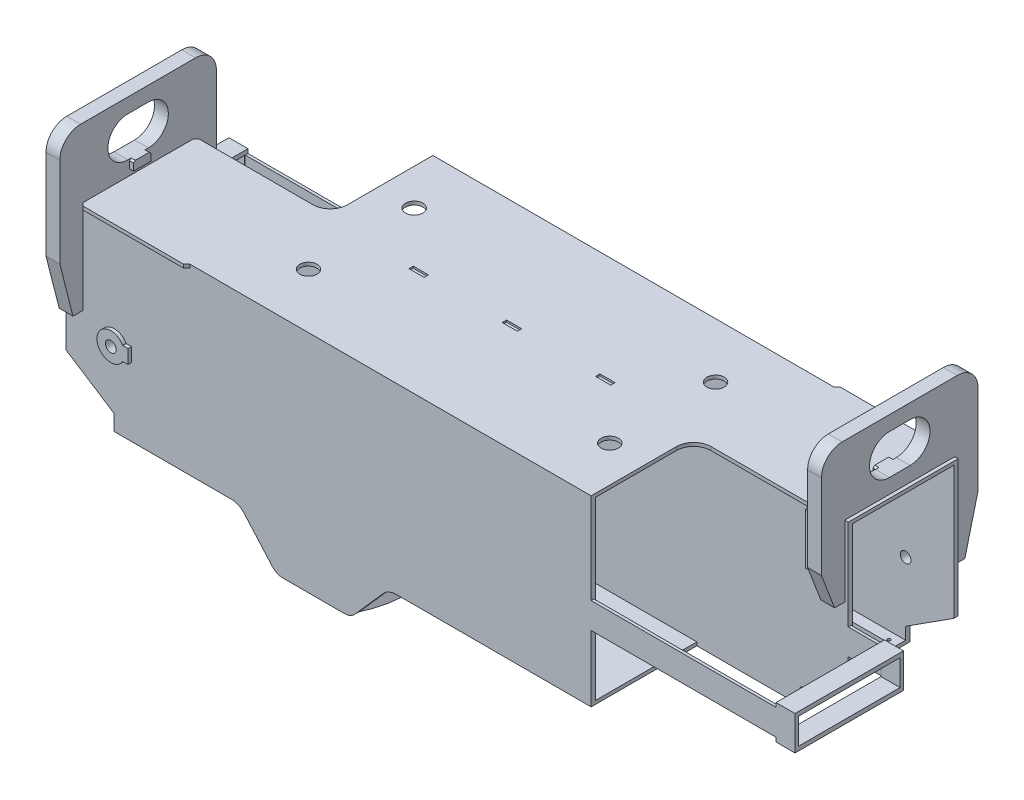
from build123d import *

# Parameters (mm, degrees)
EXTRUDE_1_DEPTH           = 12
EXTRUDE_2_DEPTH           = 12
SKETCH_4_R                = 15.5
CUT_EXTRUDE_1_DEPTH       = 12
EXTRUDE_3_DEPTH           = 12
SKETCH_7_R                = 15.5
CUT_EXTRUDE_2_DEPTH       = 12
EXTRUDE_4_DEPTH           = 10
SKETCH_11_R               = 25
CUT_EXTRUDE_4_DEPTH       = 10
SKETCH_13_W               = 44
SKETCH_13_H               = 12.5
CUT_EXTRUDE_6_DEPTH       = 10
SKETCH_14_W               = 44
SKETCH_14_H               = 12
EXTRUDE_5_DEPTH           = 5
EXTRUDE_6_DEPTH           = 10
SKETCH_17_R               = 4.5
SKETCH_17_W               = 141
SKETCH_17_H               = 31
CUT_EXTRUDE_8_DEPTH       = 10
EXTRUDE_7_DEPTH           = 10
SKETCH_20_R               = 4.5
SKETCH_20_W               = 141
SKETCH_20_H               = 31
CUT_EXTRUDE_10_DEPTH      = 10
EXTRUDE_8_DEPTH           = 40
CUT_EXTRUDE_12_DEPTH      = 40
EXTRUDE_9_DEPTH           = 40
CUT_EXTRUDE_14_DEPTH      = 40
EXTRUDE_10_DEPTH          = 12
SKETCH_31_W               = 294
SKETCH_31_H               = 130
EXTRUDE_11_DEPTH          = 10
EXTRUDE_12_DEPTH          = 294
CUT_EXTRUDE_15_DEPTH      = 2201.767422969
CUT_EXTRUDE_15_DEPTH_BACK = 2201.767422969
CUT_EXTRUDE_16_DEPTH      = 2201.767422969
CUT_EXTRUDE_16_DEPTH_BACK = 2201.767422969
EXTRUDE_13_DEPTH          = 12
SKETCH_38_W               = 294
SKETCH_38_H               = 130
EXTRUDE_14_DEPTH          = 10
EXTRUDE_15_DEPTH          = 294
CUT_EXTRUDE_17_DEPTH      = 2201.767422969
CUT_EXTRUDE_17_DEPTH_BACK = 2201.767422969
CUT_EXTRUDE_18_DEPTH      = 2201.767422969
CUT_EXTRUDE_18_DEPTH_BACK = 2201.767422969
SKETCH_44_W               = 535
SKETCH_44_H               = 75
EXTRUDE_16_DEPTH          = 8
SKETCH_45_W               = 535
SKETCH_45_H               = 75
EXTRUDE_17_DEPTH          = 8
SKETCH_47_W               = 97
SKETCH_47_H               = 75
EXTRUDE_18_DEPTH          = 8
SKETCH_48_W               = 97
SKETCH_48_H               = 75
EXTRUDE_19_DEPTH          = 8
SKETCH_50_W               = 314
SKETCH_50_H               = 99
EXTRUDE_20_DEPTH          = 55
SKETCH_52_W               = 294
SKETCH_52_H               = 75
CUT_EXTRUDE_20_DEPTH      = 55
SKETCH_54_W               = 314
SKETCH_54_H               = 99
EXTRUDE_21_DEPTH          = 55
SKETCH_56_W               = 294
SKETCH_56_H               = 75
CUT_EXTRUDE_22_DEPTH      = 55
EXTRUDE_22_DEPTH          = 12
SKETCH_58_R               = 3.4
CUT_EXTRUDE_23_DEPTH      = 12
EXTRUDE_23_DEPTH          = 12
SKETCH_60_R               = 3.4
CUT_EXTRUDE_24_DEPTH      = 12
EXTRUDE_24_DEPTH          = 8
EXTRUDE_25_DEPTH          = 8
EXTRUDE_26_DEPTH          = 12
EXTRUDE_27_DEPTH          = 12
EXTRUDE_28_DEPTH          = 7
EXTRUDE_29_DEPTH          = 7
EXTRUDE_30_DEPTH          = 10
SKETCH_73_R               = 15.5
CUT_EXTRUDE_25_DEPTH      = 10
EXTRUDE_31_DEPTH          = 10
SKETCH_76_R               = 15.5
CUT_EXTRUDE_26_DEPTH      = 10


with BuildPart() as part:
    # ｽｹｯﾁ2 → ﾎﾞｽ - 押し出し1 (new body)
    with BuildSketch(Plane.XY.offset(-306)):
        with BuildLine():
            Line((140, 0), (478.29, 0))
            ThreePointArc((478.29, 0), (498.841586236, -4.418947981), (515.760516852, -16.894707873))
            Line((515.760516852, -16.894707873), (597.563586518, -109.484233702))
            ThreePointArc((597.563586518, -109.484233702), (611.098731011, -119.464841615), (627.54, -123))
            Line((627.54, -123), (806.46, -123))
            ThreePointArc((806.46, -123), (822.901268989, -119.464841615), (836.436413482, -109.484233702))
            Line((836.436413482, -109.484233702), (918.239483148, -16.894707873))
            ThreePointArc((918.239483148, -16.894707873), (935.158413764, -4.418947981), (955.71, 0))
            Line((955.71, 0), (1002.29, 0))
            ThreePointArc((1002.29, 0), (1022.841586236, -4.418947981), (1039.760516852, -16.894707873))
            Line((1039.760516852, -16.894707873), (1121.563586518, -109.484233702))
            ThreePointArc((1121.563586518, -109.484233702), (1135.098731011, -119.464841615), (1151.54, -123))
            Line((1151.54, -123), (1330.46, -123))
            ThreePointArc((1330.46, -123), (1346.901268989, -119.464841615), (1360.436413482, -109.484233702))
            Line((1360.436413482, -109.484233702), (1442.239483148, -16.894707873))
            ThreePointArc((1442.239483148, -16.894707873), (1459.158413764, -4.418947981), (1479.71, 0))
            Line((1479.71, 0), (1818, 0))
            Line((1818, 0), (1818, 45))
            Line((1818, 45), (1958, 135))
            Line((1958, 135), (1958, 519))
            Line((1958, 519), (0, 519))
            Line((0, 519), (0, 135))
            Line((0, 135), (140, 45))
            Line((140, 45), (140, 0))
        make_face()
    extrude(amount=-EXTRUDE_1_DEPTH)



with BuildPart() as body_2:
    # ｽｹｯﾁ3 → ﾎﾞｽ - 押し出し2 (new body)
    with BuildSketch(Plane.XY):
        with BuildLine():
            Line((140, 0), (478.29, 0))
            ThreePointArc((478.29, 0), (498.841586236, -4.418947981), (515.760516852, -16.894707873))
            Line((515.760516852, -16.894707873), (597.563586518, -109.484233702))
            ThreePointArc((597.563586518, -109.484233702), (611.098731011, -119.464841615), (627.54, -123))
            Line((627.54, -123), (806.46, -123))
            ThreePointArc((806.46, -123), (822.901268989, -119.464841615), (836.436413482, -109.484233702))
            Line((836.436413482, -109.484233702), (918.239483148, -16.894707873))
            ThreePointArc((918.239483148, -16.894707873), (935.158413764, -4.418947981), (955.71, 0))
            Line((955.71, 0), (1520, 0))
            Line((1520, 0), (1520, 519))
            Line((1520, 519), (0, 519))
            Line((0, 519), (0, 135))
            Line((0, 135), (140, 45))
            Line((140, 45), (140, 0))
        make_face()
    extrude(amount=-EXTRUDE_2_DEPTH)

    # ｽｹｯﾁ4 → ｶｯﾄ - 押し出し1 (cut)
    with BuildSketch(Plane.XY):
        with Locations((140, 218)):
            Circle(SKETCH_4_R)
    extrude(amount=-CUT_EXTRUDE_1_DEPTH, mode=Mode.SUBTRACT)


with BuildPart() as body_3:
    # ｽｹｯﾁ6 → ﾎﾞｽ - 押し出し3 (new body)
    with BuildSketch(Plane.XY.offset(-612)):
        with BuildLine():
            Line((1818, 0), (1479.71, 0))
            ThreePointArc((1479.71, 0), (1459.158413764, -4.418947981), (1442.239483148, -16.894707873))
            Line((1442.239483148, -16.894707873), (1360.436413482, -109.484233702))
            ThreePointArc((1360.436413482, -109.484233702), (1346.901268989, -119.464841615), (1330.46, -123))
            Line((1330.46, -123), (1151.54, -123))
            ThreePointArc((1151.54, -123), (1135.098731011, -119.464841615), (1121.563586518, -109.484233702))
            Line((1121.563586518, -109.484233702), (1039.760516852, -16.894707873))
            ThreePointArc((1039.760516852, -16.894707873), (1022.841586236, -4.418947981), (1002.29, 0))
            Line((1002.29, 0), (438, 0))
            Line((438, 0), (438, 519))
            Line((438, 519), (1958, 519))
            Line((1958, 519), (1958, 135))
            Line((1958, 135), (1818, 45))
            Line((1818, 45), (1818, 0))
        make_face()
    extrude(amount=-EXTRUDE_3_DEPTH)

    # ｽｹｯﾁ7 → ｶｯﾄ - 押し出し2 (cut)
    with BuildSketch(Plane.XY.offset(-612)):
        with Locations((1818, 218)):
            Circle(SKETCH_7_R)
    extrude(amount=-CUT_EXTRUDE_2_DEPTH, mode=Mode.SUBTRACT)


with BuildPart() as part_1:
    add(part.part)

    add(body_2.part)  # ﾎﾞｽ - 押し出し4 merges body 2

    add(body_3.part)  # ﾎﾞｽ - 押し出し4 merges body 3
    # ｽｹｯﾁ9 → ﾎﾞｽ - 押し出し4 (add)
    with BuildSketch(Plane(origin=(0, 519, 0), x_dir=(1, 0, 0), z_dir=(0, 1, 0))):
        with BuildLine():
            Line((0, 0), (50, 0))
            Line((50, 0), (59, -9))
            Line((59, -9), (350, -9))
            Line((350, -9), (359, 0))
            Line((359, 0), (1520, 0))
            Line((1520, 0), (1520, 247))
            ThreePointArc((1520, 247), (1534.644660941, 282.355339059), (1570, 297))
            Line((1570, 297), (1899, 297))
            Line((1899, 297), (1908, 306))
            Line((1908, 306), (1958, 306))
            Line((1958, 306), (1958, 624))
            Line((1958, 624), (1908, 624))
            Line((1908, 624), (1899, 633))
            Line((1899, 633), (1608, 633))
            Line((1608, 633), (1599, 624))
            Line((1599, 624), (438, 624))
            Line((438, 624), (438, 377))
            ThreePointArc((438, 377), (423.355339059, 341.644660941), (388, 327))
            Line((388, 327), (59, 327))
            Line((59, 327), (50, 318))
            Line((50, 318), (0, 318))
            Line((0, 318), (0, 0))
        make_face()
    extrude(amount=EXTRUDE_4_DEPTH)

    # ｽｹｯﾁ11 → ｶｯﾄ - 押し出し4 (cut)
    with BuildSketch(Plane(origin=(0, 519, 0), x_dir=(1, 0, 0), z_dir=(0, 1, 0))):
        with Locations((543, 159)):
            Circle(SKETCH_11_R)
        with Locations((1415, 159)):
            Circle(SKETCH_11_R)
        with Locations((543, 465)):
            Circle(SKETCH_11_R)
        with Locations((1415, 465)):
            Circle(SKETCH_11_R)
    extrude(amount=CUT_EXTRUDE_4_DEPTH, mode=Mode.SUBTRACT)

    # ｽｹｯﾁ13 → ｶｯﾄ - 押し出し6 (cut)
    with BuildSketch(Plane(origin=(0, 519, 0), x_dir=(1, 0, 0), z_dir=(0, 1, 0))):
        with Locations((709, 312)):
            Rectangle(SKETCH_13_W, SKETCH_13_H)
        with Locations((979, 312)):
            Rectangle(SKETCH_13_W, SKETCH_13_H)
        with Locations((1249, 312)):
            Rectangle(SKETCH_13_W, SKETCH_13_H)
    extrude(amount=CUT_EXTRUDE_6_DEPTH, mode=Mode.SUBTRACT)

    # ｽｹｯﾁ14 → ﾎﾞｽ - 押し出し5 (add)
    with BuildSketch(Plane(origin=(0, 519, 0), x_dir=(1, 0, 0), z_dir=(0, 1, 0))):
        with Locations((709, 312)):
            Rectangle(SKETCH_14_W, SKETCH_14_H)
        with Locations((979, 312)):
            Rectangle(SKETCH_14_W, SKETCH_14_H)
        with Locations((1249, 312)):
            Rectangle(SKETCH_14_W, SKETCH_14_H)
    extrude(amount=EXTRUDE_5_DEPTH)

    # ｽｹｯﾁ15 → ﾎﾞｽ - 押し出し6 (add)
    with BuildSketch(Plane(origin=(0, 0, 0), x_dir=(1, 0, 0), z_dir=(0, 1, 0))):
        with BuildLine():
            Line((140, 12), (1520, 12))
            Line((1520, 12), (1520, 306))
            Line((1520, 306), (140, 306))
            Line((140, 306), (140, 204))
            Line((140, 204), (170, 204))
            ThreePointArc((170, 204), (201.819805153, 190.819805153), (215, 159))
            ThreePointArc((215, 159), (201.819805153, 127.180194847), (170, 114))
            Line((170, 114), (140, 114))
            Line((140, 114), (140, 12))
        make_face()
    extrude(amount=EXTRUDE_6_DEPTH)

    # ｽｹｯﾁ17 → ｶｯﾄ - 押し出し8 (cut)
    with BuildSketch(Plane(origin=(0, 0, 0), x_dir=(1, 0, 0), z_dir=(0, 1, 0))):
        with Locations((165.5, 34.5)):
            Circle(SKETCH_17_R)
        with Locations((293.5, 34.5)):
            Circle(SKETCH_17_R)
        with Locations((165.5, 82.5)):
            Circle(SKETCH_17_R)
        with Locations((293.5, 82.5)):
            Circle(SKETCH_17_R)
        with Locations((165.5, 235.5)):
            Circle(SKETCH_17_R)
        with Locations((293.5, 235.5)):
            Circle(SKETCH_17_R)
        with Locations((165.5, 283.5)):
            Circle(SKETCH_17_R)
        with Locations((293.5, 283.5)):
            Circle(SKETCH_17_R)
        with Locations((229.5, 58.5)):
            Rectangle(SKETCH_17_W, SKETCH_17_H)
        with Locations((229.5, 259.5)):
            Rectangle(SKETCH_17_W, SKETCH_17_H)
    extrude(amount=CUT_EXTRUDE_8_DEPTH, mode=Mode.SUBTRACT)

    # ｽｹｯﾁ18 → ﾎﾞｽ - 押し出し7 (add)
    with BuildSketch(Plane(origin=(0, 0, 0), x_dir=(1, 0, 0), z_dir=(0, 1, 0))):
        with BuildLine():
            Line((1818, 612), (438, 612))
            Line((438, 612), (438, 318))
            Line((438, 318), (1818, 318))
            Line((1818, 318), (1818, 420))
            Line((1818, 420), (1788, 420))
            ThreePointArc((1788, 420), (1756.180194847, 433.180194847), (1743, 465))
            ThreePointArc((1743, 465), (1756.180194847, 496.819805153), (1788, 510))
            Line((1788, 510), (1818, 510))
            Line((1818, 510), (1818, 612))
        make_face()
    extrude(amount=EXTRUDE_7_DEPTH)

    # ｽｹｯﾁ20 → ｶｯﾄ - 押し出し10 (cut)
    with BuildSketch(Plane(origin=(0, 0, 0), x_dir=(1, 0, 0), z_dir=(0, 1, 0))):
        with Locations((1792.5, 589.5)):
            Circle(SKETCH_20_R)
        with Locations((1664.5, 589.5)):
            Circle(SKETCH_20_R)
        with Locations((1792.5, 541.5)):
            Circle(SKETCH_20_R)
        with Locations((1664.5, 541.5)):
            Circle(SKETCH_20_R)
        with Locations((1792.5, 388.5)):
            Circle(SKETCH_20_R)
        with Locations((1664.5, 388.5)):
            Circle(SKETCH_20_R)
        with Locations((1792.5, 340.5)):
            Circle(SKETCH_20_R)
        with Locations((1664.5, 340.5)):
            Circle(SKETCH_20_R)
        with Locations((1728.5, 565.5)):
            Rectangle(SKETCH_20_W, SKETCH_20_H)
        with Locations((1728.5, 364.5)):
            Rectangle(SKETCH_20_W, SKETCH_20_H)
    extrude(amount=CUT_EXTRUDE_10_DEPTH, mode=Mode.SUBTRACT)

    # ｽｹｯﾁ22 → ﾎﾞｽ - 押し出し8 (add)
    with BuildSketch(Plane(origin=(10, 0, 0), x_dir=(0, 0, -1), z_dir=(1, 0, 0))):
        with BuildLine():
            Line((0, 259), (-29.5, 259))
            Line((-29.5, 259), (-67.5, 409))
            Line((-67.5, 409), (-67.5, 669))
            ThreePointArc((-67.5, 669), (-49.926406871, 711.426406871), (-7.5, 729))
            Line((-7.5, 729), (325.5, 729))
            ThreePointArc((325.5, 729), (367.926406871, 711.426406871), (385.5, 669))
            Line((385.5, 669), (385.5, 424))
            Line((385.5, 424), (347.5, 324))
            Line((347.5, 324), (318, 324))
            Line((318, 324), (318, 529))
            Line((318, 529), (0, 529))
            Line((0, 529), (0, 259))
        make_face()
    extrude(amount=EXTRUDE_8_DEPTH)

    # ｽｹｯﾁ24 → ｶｯﾄ - 押し出し12 (cut)
    with BuildSketch(Plane(origin=(10, 0, 0), x_dir=(0, 0, -1), z_dir=(1, 0, 0))):
        with BuildLine():
            Line((129, 686.5), (189, 686.5))
            ThreePointArc((189, 686.5), (229.658639918, 669.658639918), (246.5, 629))
            ThreePointArc((246.5, 629), (229.658639918, 588.341360082), (189, 571.5))
            Line((189, 571.5), (129, 571.5))
            ThreePointArc((129, 571.5), (88.341360082, 588.341360082), (71.5, 629))
            ThreePointArc((71.5, 629), (88.341360082, 669.658639918), (129, 686.5))
        make_face()
    extrude(amount=CUT_EXTRUDE_12_DEPTH, mode=Mode.SUBTRACT)

    # ｽｹｯﾁ26 → ﾎﾞｽ - 押し出し9 (add)
    with BuildSketch(Plane(origin=(1908, 0, 0), x_dir=(0, 0, -1), z_dir=(1, 0, 0))):
        with BuildLine():
            Line((624, 259), (653.5, 259))
            Line((653.5, 259), (691.5, 409))
            Line((691.5, 409), (691.5, 669))
            ThreePointArc((691.5, 669), (673.926406871, 711.426406871), (631.5, 729))
            Line((631.5, 729), (298.5, 729))
            ThreePointArc((298.5, 729), (256.073593129, 711.426406871), (238.5, 669))
            Line((238.5, 669), (238.5, 424))
            Line((238.5, 424), (276.5, 324))
            Line((276.5, 324), (306, 324))
            Line((306, 324), (306, 529))
            Line((306, 529), (624, 529))
            Line((624, 529), (624, 259))
        make_face()
    extrude(amount=EXTRUDE_9_DEPTH)

    # ｽｹｯﾁ28 → ｶｯﾄ - 押し出し14 (cut)
    with BuildSketch(Plane(origin=(1908, 0, 0), x_dir=(0, 0, -1), z_dir=(1, 0, 0))):
        with BuildLine():
            Line((495, 686.5), (435, 686.5))
            ThreePointArc((435, 686.5), (394.341360082, 669.658639918), (377.5, 629))
            ThreePointArc((377.5, 629), (394.341360082, 588.341360082), (435, 571.5))
            Line((435, 571.5), (495, 571.5))
            ThreePointArc((495, 571.5), (535.658639918, 588.341360082), (552.5, 629))
            ThreePointArc((552.5, 629), (535.658639918, 669.658639918), (495, 686.5))
        make_face()
    extrude(amount=CUT_EXTRUDE_14_DEPTH, mode=Mode.SUBTRACT)

    # ｽｹｯﾁ29 → ﾎﾞｽ - 押し出し10 (add)
    with BuildSketch(Plane(origin=(0, 0, 0), x_dir=(1, 0, 0), z_dir=(0, 1, 0))):
        Polygon((657, 27), (777, 27), (782, 32), (782, 286), (777, 291), (657, 291), (652, 286), (652, 32), align=None)
    extrude(amount=-EXTRUDE_10_DEPTH)

    # ｽｹｯﾁ31 → ﾎﾞｽ - 押し出し11 (add)
    with BuildSketch(Plane(origin=(712, 0, 0), x_dir=(0, 0, -1), z_dir=(1, 0, 0))):
        with Locations((159, -80)):
            Rectangle(SKETCH_31_W, SKETCH_31_H)
    extrude(amount=EXTRUDE_11_DEPTH)

    # ｽｹｯﾁ33 → ﾎﾞｽ - 押し出し12 (add)
    with BuildSketch(Plane.XY.offset(-12)):
        Polygon((761, -15), (772.547005384, -15), (847.602540378, -145), (836.055534995, -145), align=None)
        Polygon((673, -15), (661.452994616, -15), (586.397459622, -145), (597.944465005, -145), align=None)
    extrude(amount=-EXTRUDE_12_DEPTH)

    # ｽｹｯﾁ34 → ｶｯﾄ - 押し出し15 (cut, two sides: drawn at the far end of the back side and taken through both)
    with BuildSketch(Plane(origin=(0, 0, 0), x_dir=(0, 0, -1), z_dir=(1, 0, 0)).offset(-CUT_EXTRUDE_15_DEPTH_BACK)):
        with BuildLine():
            Line((306, -114.103341669), (306, -260))
            Line((306, -260), (12, -260))
            Line((12, -260), (12, -114.103341669))
            ThreePointArc((12, -114.103341669), (159, -131.93), (306, -114.103341669))
        make_face()
    extrude(amount=CUT_EXTRUDE_15_DEPTH + CUT_EXTRUDE_15_DEPTH_BACK, mode=Mode.SUBTRACT)

    # ｽｹｯﾁ35 → ｶｯﾄ - 押し出し16 (cut, two sides: drawn at the far end of the back side and taken through both)
    with BuildSketch(Plane(origin=(0, 0, 0), x_dir=(0, 0, -1), z_dir=(1, 0, 0)).offset(-CUT_EXTRUDE_16_DEPTH_BACK)):
        with BuildLine():
            Line((119, -40), (199, -40))
            ThreePointArc((199, -40), (220.213203436, -48.786796564), (229, -70))
            ThreePointArc((229, -70), (220.213203436, -91.213203436), (199, -100))
            Line((199, -100), (119, -100))
            ThreePointArc((119, -100), (97.786796564, -91.213203436), (89, -70))
            ThreePointArc((89, -70), (97.786796564, -48.786796564), (119, -40))
        make_face()
    extrude(amount=CUT_EXTRUDE_16_DEPTH + CUT_EXTRUDE_16_DEPTH_BACK, mode=Mode.SUBTRACT)

    # ｽｹｯﾁ36 → ﾎﾞｽ - 押し出し13 (add)
    with BuildSketch(Plane(origin=(0, 0, 0), x_dir=(1, 0, 0), z_dir=(0, 1, 0))):
        Polygon((1181, 333), (1301, 333), (1306, 338), (1306, 592), (1301, 597), (1181, 597), (1176, 592), (1176, 338), align=None)
    extrude(amount=-EXTRUDE_13_DEPTH)

    # ｽｹｯﾁ38 → ﾎﾞｽ - 押し出し14 (add)
    with BuildSketch(Plane(origin=(1236, 0, 0), x_dir=(0, 0, -1), z_dir=(1, 0, 0))):
        with Locations((465, -80)):
            Rectangle(SKETCH_38_W, SKETCH_38_H)
    extrude(amount=EXTRUDE_14_DEPTH)

    # ｽｹｯﾁ40 → ﾎﾞｽ - 押し出し15 (add)
    with BuildSketch(Plane.XY.offset(-318)):
        Polygon((1285, -15), (1296.547005384, -15), (1371.602540378, -145), (1360.055534995, -145), align=None)
        Polygon((1197, -15), (1185.452994616, -15), (1110.397459622, -145), (1121.944465005, -145), align=None)
    extrude(amount=-EXTRUDE_15_DEPTH)

    # ｽｹｯﾁ41 → ｶｯﾄ - 押し出し17 (cut, two sides: drawn at the far end of the back side and taken through both)
    with BuildSketch(Plane(origin=(0, 0, 0), x_dir=(0, 0, -1), z_dir=(1, 0, 0)).offset(-CUT_EXTRUDE_17_DEPTH_BACK)):
        with BuildLine():
            Line((612, -114.103341669), (612, -260))
            Line((612, -260), (318, -260))
            Line((318, -260), (318, -114.103341669))
            ThreePointArc((318, -114.103341669), (465, -131.93), (612, -114.103341669))
        make_face()
    extrude(amount=CUT_EXTRUDE_17_DEPTH + CUT_EXTRUDE_17_DEPTH_BACK, mode=Mode.SUBTRACT)

    # ｽｹｯﾁ42 → ｶｯﾄ - 押し出し18 (cut, two sides: drawn at the far end of the back side and taken through both)
    with BuildSketch(Plane(origin=(0, 0, 0), x_dir=(0, 0, -1), z_dir=(1, 0, 0)).offset(-CUT_EXTRUDE_18_DEPTH_BACK)):
        with BuildLine():
            Line((425, -40), (505, -40))
            ThreePointArc((505, -40), (526.213203436, -48.786796564), (535, -70))
            ThreePointArc((535, -70), (526.213203436, -91.213203436), (505, -100))
            Line((505, -100), (425, -100))
            ThreePointArc((425, -100), (403.786796564, -91.213203436), (395, -70))
            ThreePointArc((395, -70), (403.786796564, -48.786796564), (425, -40))
        make_face()
    extrude(amount=CUT_EXTRUDE_18_DEPTH + CUT_EXTRUDE_18_DEPTH_BACK, mode=Mode.SUBTRACT)

    # ｽｹｯﾁ44 → ﾎﾞｽ - 押し出し16 (add)
    with BuildSketch(Plane.XY.offset(-616)):
        with Locations((170.5, 229)):
            Rectangle(SKETCH_44_W, SKETCH_44_H)
    extrude(amount=-EXTRUDE_16_DEPTH)

    # ｽｹｯﾁ45 → ﾎﾞｽ - 押し出し17 (add)
    with BuildSketch(Plane.XY):
        with Locations((1787.5, 229)):
            Rectangle(SKETCH_45_W, SKETCH_45_H)
    extrude(amount=-EXTRUDE_17_DEPTH)

    # ｽｹｯﾁ47 → ﾎﾞｽ - 押し出し18 (add)
    with BuildSketch(Plane.XY.offset(-310)):
        with Locations((-48.5, 229)):
            Rectangle(SKETCH_47_W, SKETCH_47_H)
    extrude(amount=-EXTRUDE_18_DEPTH)

    # ｽｹｯﾁ48 → ﾎﾞｽ - 押し出し19 (add)
    with BuildSketch(Plane.XY.offset(-306)):
        with Locations((2006.5, 229)):
            Rectangle(SKETCH_48_W, SKETCH_48_H)
    extrude(amount=-EXTRUDE_19_DEPTH)

    # ｽｹｯﾁ50 → ﾎﾞｽ - 押し出し20 (add)
    with BuildSketch(Plane(origin=(-152, 0, 0), x_dir=(0, 0, -1), z_dir=(1, 0, 0))):
        with Locations((467, 229)):
            Rectangle(SKETCH_50_W, SKETCH_50_H)
    extrude(amount=EXTRUDE_20_DEPTH)

    # ｽｹｯﾁ52 → ｶｯﾄ - 押し出し20 (cut)
    with BuildSketch(Plane(origin=(-152, 0, 0), x_dir=(0, 0, -1), z_dir=(1, 0, 0))):
        with Locations((467, 229)):
            Rectangle(SKETCH_52_W, SKETCH_52_H)
    extrude(amount=CUT_EXTRUDE_20_DEPTH, mode=Mode.SUBTRACT)

    # ｽｹｯﾁ54 → ﾎﾞｽ - 押し出し21 (add)
    with BuildSketch(Plane(origin=(2055, 0, 0), x_dir=(0, 0, -1), z_dir=(1, 0, 0))):
        with Locations((157, 229)):
            Rectangle(SKETCH_54_W, SKETCH_54_H)
    extrude(amount=EXTRUDE_21_DEPTH)

    # ｽｹｯﾁ56 → ｶｯﾄ - 押し出し22 (cut)
    with BuildSketch(Plane(origin=(2055, 0, 0), x_dir=(0, 0, -1), z_dir=(1, 0, 0))):
        with Locations((157, 229)):
            Rectangle(SKETCH_56_W, SKETCH_56_H)
    extrude(amount=CUT_EXTRUDE_22_DEPTH, mode=Mode.SUBTRACT)

    # ｽｹｯﾁ57 → ﾎﾞｽ - 押し出し22 (add)
    with BuildSketch(Plane(origin=(0, 0, 0), x_dir=(1, 0, 0), z_dir=(0, 1, 0))):
        with BuildLine():
            Line((152, 26), (307, 26))
            ThreePointArc((307, 26), (310.535533906, 27.464466094), (312, 31))
            Line((312, 31), (312, 86))
            ThreePointArc((312, 86), (310.535533906, 89.535533906), (307, 91))
            Line((307, 91), (152, 91))
            ThreePointArc((152, 91), (148.464466094, 89.535533906), (147, 86))
            Line((147, 86), (147, 31))
            ThreePointArc((147, 31), (148.464466094, 27.464466094), (152, 26))
        make_face()
        with BuildLine():
            Line((152, 227), (307, 227))
            ThreePointArc((307, 227), (310.535533906, 228.464466094), (312, 232))
            Line((312, 232), (312, 287))
            ThreePointArc((312, 287), (310.535533906, 290.535533906), (307, 292))
            Line((307, 292), (152, 292))
            ThreePointArc((152, 292), (148.464466094, 290.535533906), (147, 287))
            Line((147, 287), (147, 232))
            ThreePointArc((147, 232), (148.464466094, 228.464466094), (152, 227))
        make_face()
    extrude(amount=-EXTRUDE_22_DEPTH)

    # ｽｹｯﾁ58 → ｶｯﾄ - 押し出し23 (cut)
    with BuildSketch(Plane(origin=(0, 0, 0), x_dir=(1, 0, 0), z_dir=(0, 1, 0))):
        with Locations((165.5, 34.5)):
            Circle(SKETCH_58_R)
        with Locations((165.5, 82.5)):
            Circle(SKETCH_58_R)
        with Locations((293.5, 34.5)):
            Circle(SKETCH_58_R)
        with Locations((293.5, 82.5)):
            Circle(SKETCH_58_R)
        with Locations((165.5, 235.5)):
            Circle(SKETCH_58_R)
        with Locations((165.5, 283.5)):
            Circle(SKETCH_58_R)
        with Locations((293.5, 235.5)):
            Circle(SKETCH_58_R)
        with Locations((293.5, 283.5)):
            Circle(SKETCH_58_R)
        with BuildLine():
            Line((174.5, 74), (284.5, 74))
            ThreePointArc((284.5, 74), (295.460155108, 69.460155108), (300, 58.5))
            ThreePointArc((300, 58.5), (295.460155108, 47.539844892), (284.5, 43))
            Line((284.5, 43), (174.5, 43))
            ThreePointArc((174.5, 43), (163.539844892, 47.539844892), (159, 58.5))
            ThreePointArc((159, 58.5), (163.539844892, 69.460155108), (174.5, 74))
        make_face()
        with BuildLine():
            Line((174.5, 275), (284.5, 275))
            ThreePointArc((284.5, 275), (295.460155108, 270.460155108), (300, 259.5))
            ThreePointArc((300, 259.5), (295.460155108, 248.539844892), (284.5, 244))
            Line((284.5, 244), (174.5, 244))
            ThreePointArc((174.5, 244), (163.539844892, 248.539844892), (159, 259.5))
            ThreePointArc((159, 259.5), (163.539844892, 270.460155108), (174.5, 275))
        make_face()
    extrude(amount=-CUT_EXTRUDE_23_DEPTH, mode=Mode.SUBTRACT)

    # ｽｹｯﾁ59 → ﾎﾞｽ - 押し出し23 (add)
    with BuildSketch(Plane(origin=(0, 0, 0), x_dir=(1, 0, 0), z_dir=(0, 1, 0))):
        with BuildLine():
            Line((1651, 533), (1806, 533))
            ThreePointArc((1806, 533), (1809.535533906, 534.464466094), (1811, 538))
            Line((1811, 538), (1811, 593))
            ThreePointArc((1811, 593), (1809.535533906, 596.535533906), (1806, 598))
            Line((1806, 598), (1651, 598))
            ThreePointArc((1651, 598), (1647.464466094, 596.535533906), (1646, 593))
            Line((1646, 593), (1646, 538))
            ThreePointArc((1646, 538), (1647.464466094, 534.464466094), (1651, 533))
        make_face()
        with BuildLine():
            Line((1651, 332), (1806, 332))
            ThreePointArc((1806, 332), (1809.535533906, 333.464466094), (1811, 337))
            Line((1811, 337), (1811, 392))
            ThreePointArc((1811, 392), (1809.535533906, 395.535533906), (1806, 397))
            Line((1806, 397), (1651, 397))
            ThreePointArc((1651, 397), (1647.464466094, 395.535533906), (1646, 392))
            Line((1646, 392), (1646, 337))
            ThreePointArc((1646, 337), (1647.464466094, 333.464466094), (1651, 332))
        make_face()
    extrude(amount=-EXTRUDE_23_DEPTH)

    # ｽｹｯﾁ60 → ｶｯﾄ - 押し出し24 (cut)
    with BuildSketch(Plane(origin=(0, 0, 0), x_dir=(1, 0, 0), z_dir=(0, 1, 0))):
        with Locations((1664.5, 541.5)):
            Circle(SKETCH_60_R)
        with Locations((1664.5, 589.5)):
            Circle(SKETCH_60_R)
        with Locations((1792.5, 541.5)):
            Circle(SKETCH_60_R)
        with Locations((1792.5, 589.5)):
            Circle(SKETCH_60_R)
        with Locations((1664.5, 340.5)):
            Circle(SKETCH_60_R)
        with Locations((1664.5, 388.5)):
            Circle(SKETCH_60_R)
        with Locations((1792.5, 340.5)):
            Circle(SKETCH_60_R)
        with Locations((1792.5, 388.5)):
            Circle(SKETCH_60_R)
        with BuildLine():
            Line((1673.5, 581), (1783.5, 581))
            ThreePointArc((1783.5, 581), (1794.460155108, 576.460155108), (1799, 565.5))
            ThreePointArc((1799, 565.5), (1794.460155108, 554.539844892), (1783.5, 550))
            Line((1783.5, 550), (1673.5, 550))
            ThreePointArc((1673.5, 550), (1662.539844892, 554.539844892), (1658, 565.5))
            ThreePointArc((1658, 565.5), (1662.539844892, 576.460155108), (1673.5, 581))
        make_face()
        with BuildLine():
            Line((1673.5, 380), (1783.5, 380))
            ThreePointArc((1783.5, 380), (1794.460155108, 375.460155108), (1799, 364.5))
            ThreePointArc((1799, 364.5), (1794.460155108, 353.539844892), (1783.5, 349))
            Line((1783.5, 349), (1673.5, 349))
            ThreePointArc((1673.5, 349), (1662.539844892, 353.539844892), (1658, 364.5))
            ThreePointArc((1658, 364.5), (1662.539844892, 375.460155108), (1673.5, 380))
        make_face()
    extrude(amount=-CUT_EXTRUDE_24_DEPTH, mode=Mode.SUBTRACT)

    # ｽｹｯﾁ62 → ﾎﾞｽ - 押し出し24 (add)
    with BuildSketch(Plane(origin=(0, 511, 0), x_dir=(1, 0, 0), z_dir=(0, 1, 0))):
        Polygon((10, 12), (208, 12), (208, 38.6), (138, 57.38), (10, 57.38), align=None)
        Polygon((10, 260.62), (208, 260.62), (208, 287.22), (138, 306), (10, 306), align=None)
    extrude(amount=EXTRUDE_24_DEPTH)

    # ｽｹｯﾁ63 → ﾎﾞｽ - 押し出し25 (add)
    with BuildSketch(Plane(origin=(0, 511, 0), x_dir=(1, 0, 0), z_dir=(0, 1, 0))):
        Polygon((1948, 318), (1750, 318), (1750, 344.6), (1820, 363.38), (1948, 363.38), align=None)
        Polygon((1948, 566.62), (1750, 566.62), (1750, 593.22), (1820, 612), (1948, 612), align=None)
    extrude(amount=EXTRUDE_25_DEPTH)

    # ｽｹｯﾁ65 → ﾎﾞｽ - 押し出し26 (add)
    with BuildSketch(Plane(origin=(50, 0, 0), x_dir=(0, 0, -1), z_dir=(1, 0, 0))):
        Polygon((134, 546.5), (184, 546.5), (184, 566.5), (179, 571.5), (139, 571.5), (134, 566.5), align=None)
    extrude(amount=EXTRUDE_26_DEPTH)

    # ｽｹｯﾁ67 → ﾎﾞｽ - 押し出し27 (add)
    with BuildSketch(Plane(origin=(1896, 0, 0), x_dir=(0, 0, -1), z_dir=(1, 0, 0))):
        Polygon((440, 546.5), (490, 546.5), (490, 566.5), (485, 571.5), (445, 571.5), (440, 566.5), align=None)
    extrude(amount=EXTRUDE_27_DEPTH)

    # ｽｹｯﾁ69 → ﾎﾞｽ - 押し出し28 (add)
    with BuildSketch(Plane.XY.offset(-299)):
        Polygon((1841, 359), (1896, 359), (1896, 497.833333333), (1841, 507), align=None)
    extrude(amount=-EXTRUDE_28_DEPTH)

    # ｽｹｯﾁ70 → ﾎﾞｽ - 押し出し29 (add)
    with BuildSketch(Plane.XY.offset(-318)):
        Polygon((62, 359), (117, 359), (117, 507), (62, 497.833333333), align=None)
    extrude(amount=-EXTRUDE_29_DEPTH)

    # ｽｹｯﾁ72 → ﾎﾞｽ - 押し出し30 (add)
    with BuildSketch(Plane.XY.offset(10)):
        with BuildLine():
            Line((174.641016151, 238), (190, 238))
            Line((190, 238), (190, 198))
            Line((190, 198), (174.641016151, 198))
            ThreePointArc((174.641016151, 198), (140, 178), (105.358983849, 198))
            ThreePointArc((105.358983849, 198), (105.358983849, 238), (140, 258))
            ThreePointArc((140, 258), (160, 252.641016151), (174.641016151, 238))
        make_face()
    extrude(amount=-EXTRUDE_30_DEPTH)

    # ｽｹｯﾁ73 → ｶｯﾄ - 押し出し25 (cut)
    with BuildSketch(Plane.XY.offset(10)):
        with Locations((140, 218)):
            Circle(SKETCH_73_R)
    extrude(amount=-CUT_EXTRUDE_25_DEPTH, mode=Mode.SUBTRACT)

    # ｽｹｯﾁ75 → ﾎﾞｽ - 押し出し31 (add)
    with BuildSketch(Plane.XY.offset(-624)):
        with BuildLine():
            Line((1783.358983849, 238), (1768, 238))
            Line((1768, 238), (1768, 198))
            Line((1768, 198), (1783.358983849, 198))
            ThreePointArc((1783.358983849, 198), (1818, 178), (1852.641016151, 198))
            ThreePointArc((1852.641016151, 198), (1852.641016151, 238), (1818, 258))
            ThreePointArc((1818, 258), (1798, 252.641016151), (1783.358983849, 238))
        make_face()
    extrude(amount=-EXTRUDE_31_DEPTH)

    # ｽｹｯﾁ76 → ｶｯﾄ - 押し出し26 (cut)
    with BuildSketch(Plane.XY.offset(-624)):
        with Locations((1818, 218)):
            Circle(SKETCH_76_R)
    extrude(amount=-CUT_EXTRUDE_26_DEPTH, mode=Mode.SUBTRACT)


solid = part_1.part
